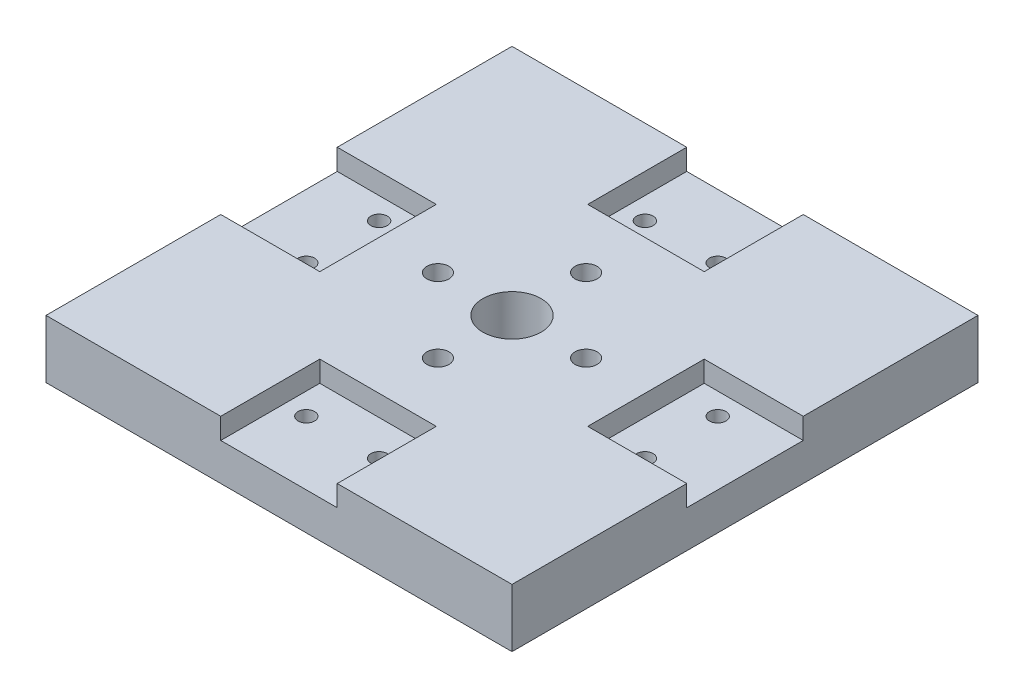
from build123d import *

# Parameters (mm, degrees)
SKETCH1_W           = 101.6
SKETCH1_H           = 101.6
BOSS_EXTRUDE1_DEPTH = 12.7
SKETCH2_W           = 25.4
SKETCH2_H           = 21.59
SKETCH2_W_2         = 21.59
SKETCH2_H_2         = 25.4
CUT_EXTRUDE1_DEPTH  = 4.572
SKETCH3_R           = 2.400000026
CUT_EXTRUDE2_DEPTH  = 145.244271983
SKETCH4_R           = 1.8034
CUT_EXTRUDE3_DEPTH  = 144.913808872
SKETCH5_R           = 6.35
CUT_EXTRUDE4_DEPTH  = 145.244271983


with BuildPart() as part:
    # Sketch1 → Boss-Extrude1 (new body)
    with BuildSketch(Plane(origin=(0, 0, 0), x_dir=(1, 0, 0), z_dir=(0, 1, 0))):
        with Locations((50.8, 50.8)):
            Rectangle(SKETCH1_W, SKETCH1_H)
    extrude(amount=BOSS_EXTRUDE1_DEPTH)

    # Sketch2 → Cut-Extrude1 (cut)
    with BuildSketch(Plane(origin=(0, 12.7, 0), x_dir=(1, 0, 0), z_dir=(0, 1, 0))):
        with Locations((50.8, 90.805)):
            Rectangle(SKETCH2_W, SKETCH2_H)
        with Locations((10.795, 50.8)):
            Rectangle(SKETCH2_W_2, SKETCH2_H_2)
        with Locations((50.8, 10.795)):
            Rectangle(SKETCH2_W, SKETCH2_H)
        with Locations((90.805, 50.8)):
            Rectangle(SKETCH2_W_2, SKETCH2_H_2)
    extrude(amount=-CUT_EXTRUDE1_DEPTH, mode=Mode.SUBTRACT)

    # Sketch3 → Cut-Extrude2 (cut, through all)
    with BuildSketch(Plane(origin=(0, 12.7, 0), x_dir=(1, 0, 0), z_dir=(0, 1, 0))):
        with Locations((34.65068, 50.8)):
            Circle(SKETCH3_R)
        with Locations((50.8, 66.94932)):
            Circle(SKETCH3_R)
        with Locations((66.94932, 50.8)):
            Circle(SKETCH3_R)
        with Locations((50.8, 34.65068)):
            Circle(SKETCH3_R)
    extrude(amount=-CUT_EXTRUDE2_DEPTH, mode=Mode.SUBTRACT)

    # Sketch4 → Cut-Extrude3 (cut, through all)
    with BuildSketch(Plane(origin=(0, 8.128, 0), x_dir=(1, 0, 0), z_dir=(0, 1, 0))):
        with Locations((87.7062, 58.7375)):
            Circle(SKETCH4_R)
        with Locations((87.7062, 42.8625)):
            Circle(SKETCH4_R)
        with Locations((58.7375, 87.7062)):
            Circle(SKETCH4_R)
        with Locations((42.8625, 87.7062)):
            Circle(SKETCH4_R)
        with Locations((13.8938, 58.7375)):
            Circle(SKETCH4_R)
        with Locations((13.8938, 42.8625)):
            Circle(SKETCH4_R)
        with Locations((42.8625, 13.8938)):
            Circle(SKETCH4_R)
        with Locations((58.7375, 13.8938)):
            Circle(SKETCH4_R)
    extrude(amount=-CUT_EXTRUDE3_DEPTH, mode=Mode.SUBTRACT)

    # Sketch5 → Cut-Extrude4 (cut, through all)
    with BuildSketch(Plane(origin=(0, 12.7, 0), x_dir=(1, 0, 0), z_dir=(0, 1, 0))):
        with Locations((50.8, 50.8)):
            Circle(SKETCH5_R)
    extrude(amount=-CUT_EXTRUDE4_DEPTH, mode=Mode.SUBTRACT)


solid = part.part
